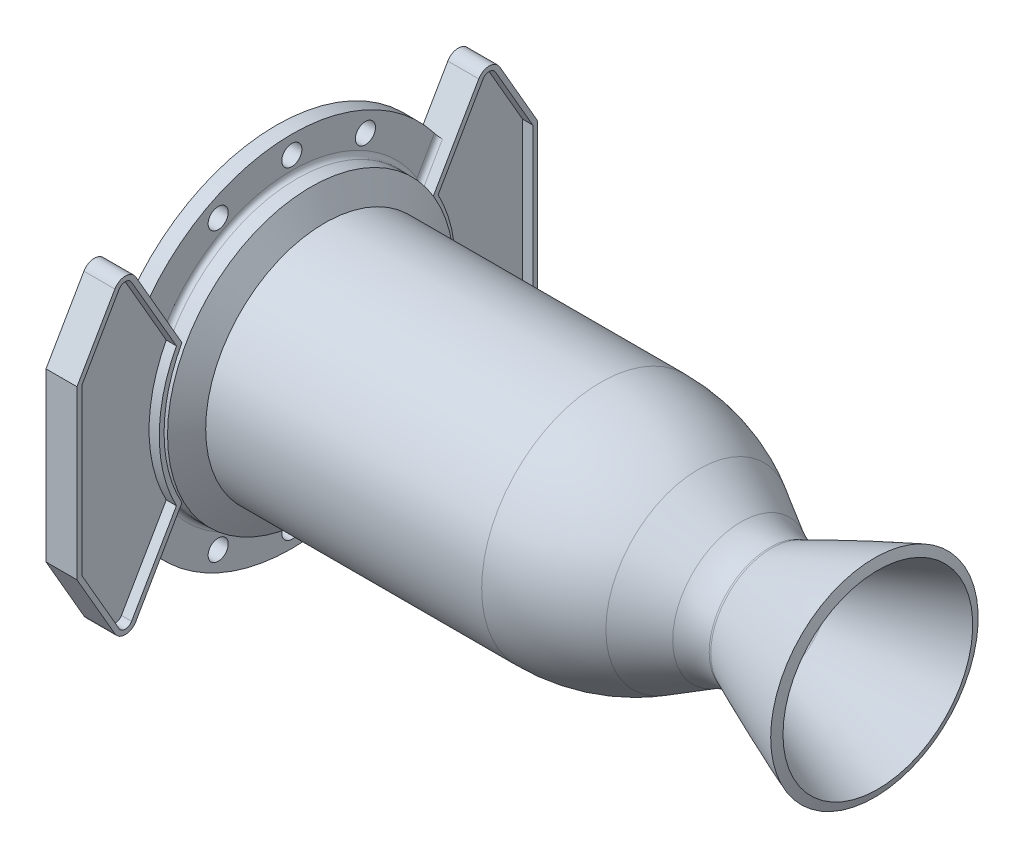
from build123d import *
from build123d.topology import SkipClean

# Parameters (mm, degrees)
BOSS_EXTRUDE1_DEPTH = 16.256
CUT_EXTRUDE1_DEPTH  = 5.334
BOSS_EXTRUDE2_START = -8.128
BOSS_EXTRUDE2_DEPTH = 8.128
FILLET2_R           = 2.54
SKETCH9_R           = 5.276996688
CUT_EXTRUDE2_DEPTH  = 344.8417333


with BuildPart() as part:
    # Sketch3 → Revolve1 (revolve)
    with BuildSketch(Plane.XY):
        with BuildLine():
            Line((0, 62.50116278), (144.934662069, 62.50116278))
            ThreePointArc((144.934662069, 62.50116278), (171.563195097, 58.995430145), (196.377031865, 48.717179445))
            Line((196.377031865, 48.717179445), (218.627148666, 35.871044168))
            ThreePointArc((218.627148666, 35.871044168), (225.918357505, 32.850926621), (233.742787922, 31.820817416))
            ThreePointArc((233.742787922, 31.820817416), (234.25849688, 31.874994553), (234.751688107, 32.035161047))
            add(Edge.make_bspline(
                [(234.751688107, 32.035161047), (237.01563786, 33.042605222), (241.558012865, 35.047750332), (250.598858454, 38.973761134), (261.865302755, 43.744407277), (273.069848062, 48.325693823), (282.005645487, 51.880791718), (286.451986012, 53.616927894), (288.682041358, 54.479389474)],
                knots=[0, 0, 0, 0, 0.049644807, 0.099289614, 0.198579228, 0.297868842, 0.347513649, 0.397158456, 0.397158456, 0.397158456, 0.397158456], degree=3))
            Line((288.682041358, 54.479389474), (290.485579361, 49.816005438))
            add(Edge.make_bspline(
                [(236.784472704, 27.467044719), (254.870236719, 35.51510214), (272.770570963, 42.964823847), (290.485579361, 49.816005438)],
                knots=[0, 0, 0, 0, 0.397158456, 0.397158456, 0.397158456, 0.397158456], degree=3))
            ThreePointArc((236.784472704, 27.467044719), (235.297572794, 26.98416423), (233.742784709, 26.820827416))
            ThreePointArc((233.742784709, 26.820827416), (224.624261333, 28.021308096), (216.127150111, 31.540927862))
            Line((216.127150111, 31.540927862), (193.87703331, 44.387063139))
            ThreePointArc((193.87703331, 44.387063139), (170.269100478, 54.165811204), (144.934662069, 57.50117278))
            Line((144.934662069, 57.50117278), (0, 57.50117278))
            Line((0, 57.50117278), (0, 62.50116278))
        make_face()
    revolve(axis=Axis((0, 0, 0), (1, 0, 0)))

    # Sketch4 → Revolve5 (revolve)
    with BuildSketch(Plane.XY):
        Polygon((-25.4, 57.50117278), (-25.4, 75.20116278), (-7.332348419, 75.20116278), (0, 62.50116278), (0, 57.50117278), align=None)
    revolve(axis=Axis((0, 0, 0), (1, 0, 0)))

    # Sketch6 → Boss-Extrude1 (add)
    with SkipClean():  # the faces are left unmerged after this step: merging them gives an invalid solid
        with BuildSketch(Plane.ZY.offset(25.4)):
            with BuildLine():
                Line((54.820128271, 17.35333995), (90.051671459, 78.37616278))
                ThreePointArc((90.051671459, 78.37616278), (95.550932773, 81.55116278), (101.050194087, 78.37616278))
                Line((101.050194087, 78.37616278), (120.950932773, 43.907072268))
                Line((120.950932773, 43.907072268), (120.950932773, -43.907072268))
                Line((120.950932773, -43.907072268), (101.050194087, -78.37616278))
                ThreePointArc((101.050194087, -78.37616278), (95.550932773, -81.55116278), (90.051671459, -78.37616278))
                Line((90.051671459, -78.37616278), (54.820128271, -17.35333995))
                ThreePointArc((54.820128271, -17.35333995), (57.50117278, 0), (54.820128271, 17.35333995))
            make_face()
            with BuildLine():
                Line((-54.820128271, -17.35333995), (-90.051671459, -78.37616278))
                ThreePointArc((-90.051671459, -78.37616278), (-95.550932773, -81.55116278), (-101.050194087, -78.37616278))
                Line((-101.050194087, -78.37616278), (-120.950932773, -43.907072268))
                Line((-120.950932773, -43.907072268), (-120.950932773, 43.907072268))
                Line((-120.950932773, 43.907072268), (-101.050194087, 78.37616278))
                ThreePointArc((-101.050194087, 78.37616278), (-95.550932773, 81.55116278), (-90.051671459, 78.37616278))
                Line((-90.051671459, 78.37616278), (-54.820128271, 17.35333995))
                ThreePointArc((-54.820128271, 17.35333995), (-57.50117278, 0), (-54.820128271, -17.35333995))
            make_face()
        extrude(amount=-BOSS_EXTRUDE1_DEPTH)

    # Sketch7 → Cut-Extrude1 (cut)
    with SkipClean():  # the faces are left unmerged after this step: merging them gives an invalid solid
        with BuildSketch(Plane(origin=(-9.144, 0, 0), x_dir=(0, 0, -1), z_dir=(1, 0, 0))):
            with BuildLine():
                Line((-68.720104511, 36.34880502), (-92.251375985, 77.10616278))
                ThreePointArc((-92.251375985, 77.10616278), (-95.550932773, 79.01116278), (-98.850489562, 77.10616278))
                Line((-98.850489562, 77.10616278), (-118.410932773, 43.226481319))
                Line((-118.410932773, 43.226481319), (-118.410932773, -43.226481319))
                Line((-118.410932773, -43.226481319), (-98.850489562, -77.10616278))
                ThreePointArc((-98.850489562, -77.10616278), (-95.550932773, -79.01116278), (-92.251375985, -77.10616278))
                Line((-92.251375985, -77.10616278), (-68.720104511, -36.34880502))
                ThreePointArc((-68.720104511, -36.34880502), (-77.74116278, 0), (-68.720104511, 36.34880502))
            make_face()
            with BuildLine():
                Line((92.251375985, -77.10616278), (68.720104511, -36.34880502))
                ThreePointArc((68.720104511, -36.34880502), (77.74116278, 0), (68.720104511, 36.34880502))
                Line((68.720104511, 36.34880502), (92.251375985, 77.10616278))
                ThreePointArc((92.251375985, 77.10616278), (95.550932773, 79.01116278), (98.850489562, 77.10616278))
                Line((98.850489562, 77.10616278), (118.410932773, 43.226481319))
                Line((118.410932773, 43.226481319), (118.410932773, -43.226481319))
                Line((118.410932773, -43.226481319), (98.850489562, -77.10616278))
                ThreePointArc((98.850489562, -77.10616278), (95.550932773, -79.01116278), (92.251375985, -77.10616278))
            make_face()
        extrude(amount=-CUT_EXTRUDE1_DEPTH, mode=Mode.SUBTRACT)

    # Sketch8 → Boss-Extrude2 (add)
    with SkipClean():  # the faces are left unmerged after this step: merging them gives an invalid solid
        with BuildSketch(Plane.ZY.offset(25.4).offset(BOSS_EXTRUDE2_START)):
            with BuildLine():
                Line((-65.810567847, -36.389339691), (-76.548297649, -54.987633268))
                ThreePointArc((-76.548297649, -54.987633268), (0, -94.25116278), (76.548297649, -54.987633268))
                Line((76.548297649, -54.987633268), (65.810567847, -36.389339691))
                ThreePointArc((65.810567847, -36.389339691), (0, -75.20116278), (-65.810567847, -36.389339691))
            make_face()
            with BuildLine():
                Line((76.548297649, 54.987633268), (65.810567847, 36.389339691))
                ThreePointArc((65.810567847, 36.389339691), (0, 75.20116278), (-65.810567847, 36.389339691))
                Line((-65.810567847, 36.389339691), (-76.548297649, 54.987633268))
                ThreePointArc((-76.548297649, 54.987633268), (0, 94.25116278), (76.548297649, 54.987633268))
            make_face()
        extrude(amount=BOSS_EXTRUDE2_DEPTH)

    # Fillet2
    fillet2_edges = [part.edges().sort_by_distance(p)[0] for p in [
        (-17.272, -45.68848648, -71.179432748),
        (-17.272, -75.20116278, 0),
        (-17.272, -45.68848648, 71.179432748),
        (-17.272, 45.68848648, 71.179432748),
        (-17.272, 64.775518296, 38.201401976),
        (-17.272, 45.68848648, -71.179432748),
    ]]
    fillet(fillet2_edges, radius=FILLET2_R)

    # Sketch9 → Cut-Extrude2 (cut, through all)
    with SkipClean():  # the faces are left unmerged after this step: merging them gives an invalid solid
        with BuildSketch(Plane(origin=(-17.272, 0, 0), x_dir=(0, 0, -1), z_dir=(1, 0, 0))):
            with Locations((-38.668190551, 75.387622983)):
                Circle(SKETCH9_R)
            with Locations((0.000121249, 84.72616278)):
                Circle(SKETCH9_R)
            with Locations((38.66840632, 75.387512308)):
                Circle(SKETCH9_R)
            with Locations((38.66840632, -75.387512308)):
                Circle(SKETCH9_R)
            with Locations((0.000121249, -84.72616278)):
                Circle(SKETCH9_R)
            with Locations((-38.668190551, -75.387622983)):
                Circle(SKETCH9_R)
        extrude(amount=-CUT_EXTRUDE2_DEPTH, mode=Mode.SUBTRACT)


solid = part.part
